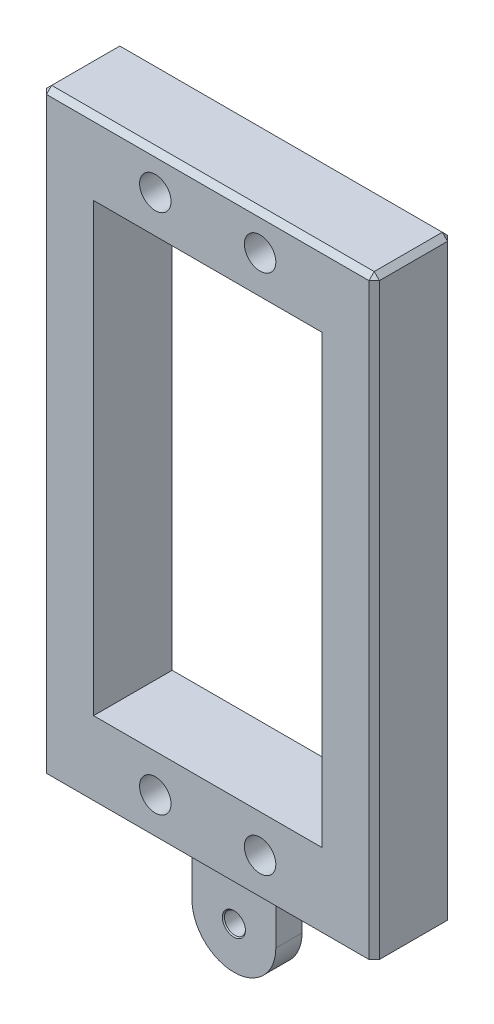
from build123d import *

# Parameters (mm, degrees)
SKETCH2_W           = 31.775877048
SKETCH2_H           = 56.6
SKETCH2_R           = 1.5
SKETCH2_W_2         = 21.775877048
SKETCH2_H_2         = 42.575877048
BOSS_EXTRUDE1_DEPTH = 7.5
SKETCH3_W           = 8
SKETCH3_H           = 2.5
BOSS_EXTRUDE2_DEPTH = 10
SKETCH4_R           = 1
CUT_EXTRUDE1_DEPTH  = 42.765016348
FILLET1_R           = 4
FILLET3_R           = 0.5
CHAMFER1_SIZE       = 0.1
CHAMFER2_SIZE       = 0.5


with BuildPart() as part:
    # Sketch2 → Boss-Extrude1 (new body)
    with BuildSketch(Plane.XY):
        Rectangle(SKETCH2_W, SKETCH2_H)
        with Locations((5, -24.889613301)):
            Circle(SKETCH2_R, mode=Mode.SUBTRACT)
        with Locations((-5, -24.889613301)):
            Circle(SKETCH2_R, mode=Mode.SUBTRACT)
        with Locations((5, 24.889613301)):
            Circle(SKETCH2_R, mode=Mode.SUBTRACT)
        with Locations((-5, 24.889613301)):
            Circle(SKETCH2_R, mode=Mode.SUBTRACT)
        Rectangle(SKETCH2_W_2, SKETCH2_H_2, mode=Mode.SUBTRACT)
    extrude(amount=BOSS_EXTRUDE1_DEPTH)

    # Sketch3 → Boss-Extrude2 (add)
    with BuildSketch(Plane.XZ.offset(28.3)):
        with Locations((0, 3.75)):
            Rectangle(SKETCH3_W, SKETCH3_H)
    extrude(amount=BOSS_EXTRUDE2_DEPTH)

    # Sketch4 → Cut-Extrude1 (cut, through all)
    with BuildSketch(Plane.XY.offset(5)):
        with Locations((0, -34.3)):
            Circle(SKETCH4_R)
    extrude(amount=-CUT_EXTRUDE1_DEPTH, mode=Mode.SUBTRACT)

    # Fillet1
    fillet1_edges = [part.edges().sort_by_distance(p)[0] for p in [
        (4, -38.3, 3.75),
        (-4, -38.3, 3.75),
    ]]
    fillet(fillet1_edges, radius=FILLET1_R - 0.0001)  # a hair under: the kernel refuses the full size

    # Fillet3
    fillet3_edges = [part.edges().sort_by_distance(p)[0] for p in [
        (-4, -28.3, 3.75),
        (0, -28.3, 2.5),
        (4, -28.3, 3.75),
        (0, -28.3, 5),
    ]]
    fillet(fillet3_edges, radius=FILLET3_R)

    # Chamfer1
    chamfer1_edges = [part.edges().sort_by_distance(p)[0] for p in [
        (-1, -34.3, 2.5),
        (-1, -34.3, 5),
    ]]
    chamfer(chamfer1_edges, length=CHAMFER1_SIZE)

    # Chamfer2
    chamfer2_edges = [part.edges().sort_by_distance(p)[0] for p in [
        (15.887938524, 0, 7.5),
        (0, 28.3, 7.5),
        (-15.887938524, 0, 7.5),
        (0, 28.3, 0),
        (15.887938524, 0, 0),
        (-15.887938524, 0, 0),
        (-15.887938524, 28.3, 3.75),
        (15.887938524, 28.3, 3.75),
    ]]
    chamfer(chamfer2_edges, length=CHAMFER2_SIZE)


solid = part.part
